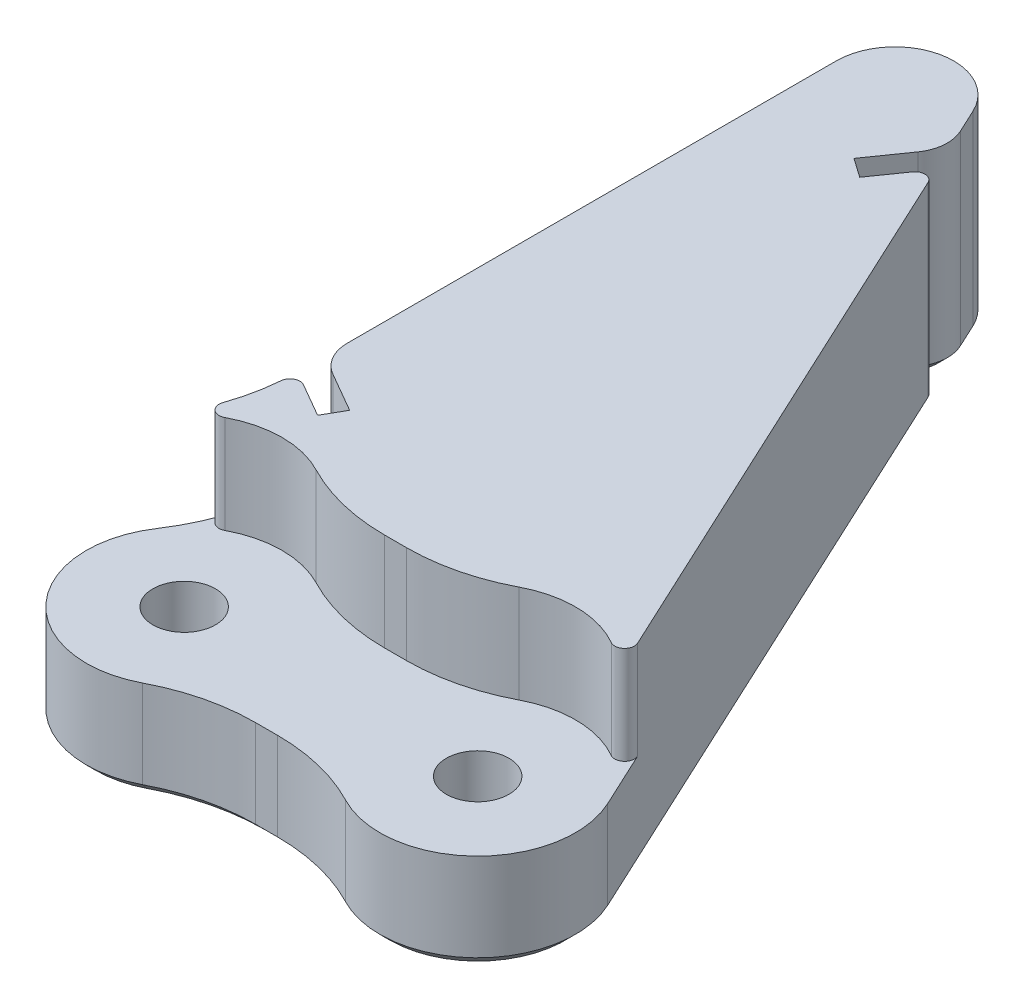
from build123d import *

# Parameters (mm, degrees)
MAIN_BODY_DEPTH                           = 10
SKETCH1_3_R                               = 1.6
CONNECTOR_BODY_DEPTH                      = 5
DULLING_FILLET_START                      = 5
DULLING_FILLET_DEPTH                      = 6
CUT_EXTRUDE1_DEPTH                        = 45.806187552
FILLET1_R                                 = 2
FILLET2_R                                 = 0.5
ELEPHANTSFOOT_COMPENSATION_LEFT_CONF_SIZE = 0.5


with BuildPart() as part:
    # complete_sketch → main_body (new body)
    with BuildSketch(Plane(origin=(0, 0, 0), x_dir=(1, 0, 0), z_dir=(0, 1, 0))):
        with BuildLine():
            ThreePointArc((-2.5, 8.291561976), (-2.925728922, 5.40481063), (-4.166666667, 2.763853992))
            ThreePointArc((-4.166666667, 2.763853992), (-1.24767584, 4.841828683), (2.312045751, 4.433333333))
            ThreePointArc((2.312045751, 4.433333333), (4.555661111, 3.587465144), (6.936137254, 3.3))
            Line((6.936137254, 3.3), (8.063862746, 3.3))
            ThreePointArc((8.063862746, 3.3), (10.444338889, 3.587465144), (12.687954249, 4.433333333))
            ThreePointArc((12.687954249, 4.433333333), (16.605433979, 4.735248857), (19.531538935, 2.113091309))
            Line((19.531538935, 2.113091309), (3.218923361, 37.095608299))
            ThreePointArc((3.218923361, 37.095608299), (-0.149318842, 38.756641535), (-2.5, 35.827753514))
            Line((-2.5, 35.827753514), (-2.5, 8.291561976))
        make_face()
    extrude(amount=MAIN_BODY_DEPTH)

    # Sketch1<3> → connector_body (add)
    with BuildSketch(Plane(origin=(0, 0, 0), x_dir=(1, 0, 0), z_dir=(0, 1, 0))):
        with BuildLine():
            ThreePointArc((2.312045751, -4.433333333), (4.555661111, -3.587465144), (6.936137254, -3.3))
            Line((6.936137254, -3.3), (8.063862746, -3.3))
            ThreePointArc((8.063862746, -3.3), (10.444338889, -3.587465144), (12.687954249, -4.433333333))
            ThreePointArc((12.687954249, -4.433333333), (18.456219958, -3.613107195), (19.531538935, 2.113091309))
            ThreePointArc((19.531538935, 2.113091309), (16.605433979, 4.735248857), (12.687954249, 4.433333333))
            ThreePointArc((12.687954249, 4.433333333), (10.444338889, 3.587465144), (8.063862746, 3.3))
            Line((8.063862746, 3.3), (6.936137254, 3.3))
            ThreePointArc((6.936137254, 3.3), (4.555661111, 3.587465144), (2.312045751, 4.433333333))
            ThreePointArc((2.312045751, 4.433333333), (-1.24767584, 4.841828683), (-4.166666667, 2.763853992))
            ThreePointArc((-4.166666667, 2.763853992), (-3.716151374, -3.345178466), (2.312045751, -4.433333333))
        make_face()
        with Locations(Location((0, 0, 0), (0, 0, 270))):
            Circle(SKETCH1_3_R, mode=Mode.SUBTRACT)
        with Locations(Location((15, 0, 0), (0, 0, 270))):
            Circle(SKETCH1_3_R, mode=Mode.SUBTRACT)
    extrude(amount=CONNECTOR_BODY_DEPTH)

    # dulling_fillet: read off the stored shape, not the designer's step
    # dulling_fillet outline → dulling_fillet (cut)
    with BuildSketch(Plane(origin=(0, 0, 0), x_dir=(1, 0, 0), z_dir=(0, 1, 0)).offset(DULLING_FILLET_START)):
        with BuildLine():
            Line((19.531538935, 2.113091309), (18.195102647, 4.979088177))
            ThreePointArc((18.195102647, 4.979088177), (18.080055144, 4.399425861), (17.492680685, 4.334344587))
            ThreePointArc((17.492680685, 4.334344587), (18.683531845, 3.381063908), (19.531538935, 2.113091309))
        make_face()
        with BuildLine():
            ThreePointArc((-4.166666667, 2.763853992), (-3.358016887, 3.704554303), (-2.342670216, 4.417227214))
            ThreePointArc((-2.342670216, 4.417227214), (-2.902133749, 4.479151002), (-3.049464036, 5.022407651))
            ThreePointArc((-3.049464036, 5.022407651), (-3.536643042, 3.85780149), (-4.166666667, 2.763853992))
        make_face()
    extrude(amount=DULLING_FILLET_DEPTH, mode=Mode.SUBTRACT)

    # Sketch2 → Cut-Extrude1 (cut, through all)
    with BuildSketch(Plane(origin=(0, 10, 0), x_dir=(1, 0, 0), z_dir=(0, 1, 0))):
        Polygon((-2.5, 8.291561976), (-0.068911087, 6.887972137), (0.531088913, 7.927202622), (-2.5, 9.677202622), align=None)
        Polygon((4.275469015, 34.829838831), (2.267951488, 31.962806676), (3.250933941, 31.274514953), (4.861066057, 33.574021924), align=None)
    extrude(amount=-CUT_EXTRUDE1_DEPTH, mode=Mode.SUBTRACT)

    # Fillet1
    fillet1_edges = [part.edges().sort_by_distance(p)[0] for p in [
        (-2.5, 5, -9.677202622),
        (4.275469015, 5, -34.829838831),
    ]]
    fillet(fillet1_edges, radius=FILLET1_R)

    # Fillet2
    fillet2_edges = [part.edges().sort_by_distance(p)[0] for p in [
        (4.861066057, 5, -33.574021924),
        (-2.5, 5, -8.291561976),
    ]]
    fillet(fillet2_edges, radius=FILLET2_R)

    # elephantsfoot_compensation_left_conf
    elephantsfoot_compensation_left_conf_edges = [part.edges().sort_by_distance(p)[0] for p in [
        (-0.484455543, 0, -8.513527487),
        (0.231088913, 0, -7.40758738),
        (3.807634117, 0, -32.069565198),
        (2.759442715, 0, -31.618660815),
        (-2.5, 0, -23.329828337),
        (-0.149318842, 0, -38.756641535),
        (2.940555742, 0, -32.923385101),
        (3.503197421, 0, -36.48598061),
        (-2.232050808, 0, -9.83190316),
        (12.379301571, 0, -17.451113833),
        (3.967245303, 0, -34.856804912),
        (-3.049950658, 0, -5.021001256),
        (-0.926536362, 0, -7.383122321),
        (-2.266493544, 0, -7.888003391),
        (4.817488185, 0, -33.075924575),
        (-3.716151374, 0, 3.345178466),
        (18.456219958, 0, 3.613107195),
        (7.5, 0, 3.3),
        (10.444338889, 0, 3.587465144),
        (0, 0, -1.6),
        (15, 0, -1.6),
        (4.555661111, 0, 3.587465144),
    ]]
    chamfer(elephantsfoot_compensation_left_conf_edges, length=ELEPHANTSFOOT_COMPENSATION_LEFT_CONF_SIZE)


solid = part.part
